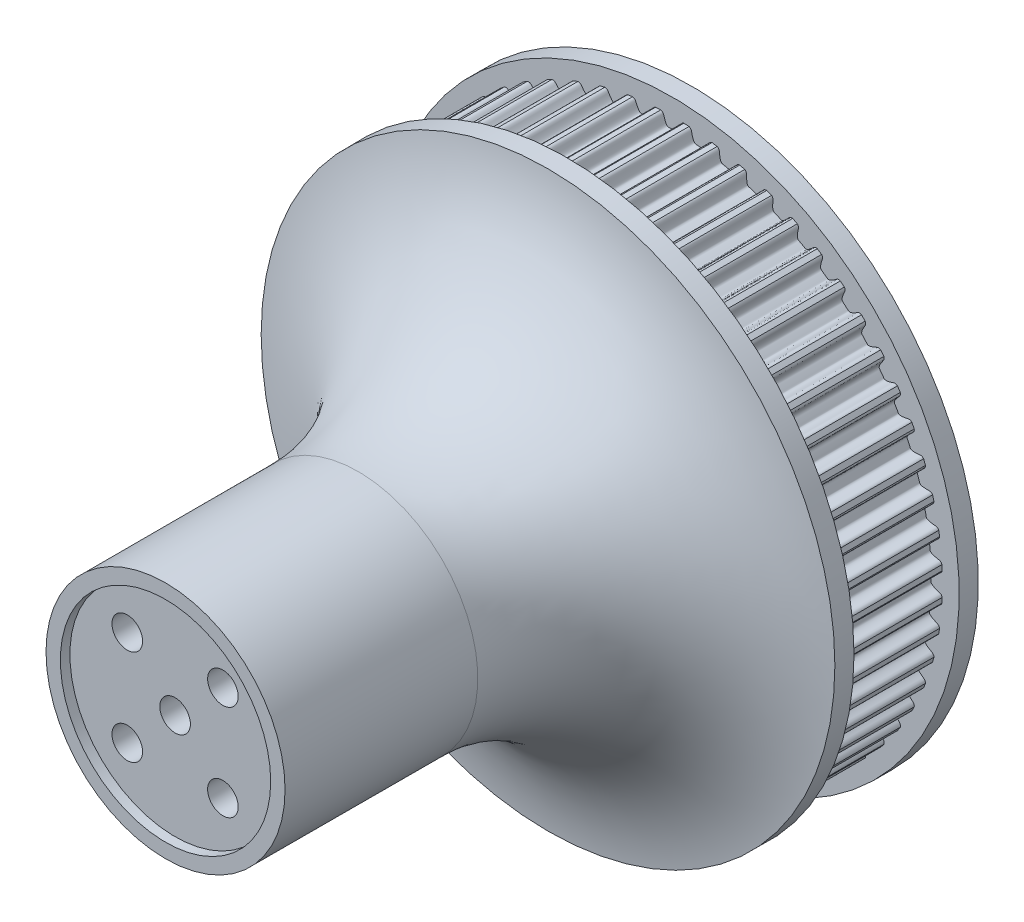
from build123d import *

# Parameters (mm, degrees)
TOOTHEXTRUDECUTGEARBELT01_DEPTH = 8.249999876
TOOTH_PATTERN_60_COUNT          = 60
BOREREVOLVESKETCH_W             = 19.547999706
BOREREVOLVESKETCH_H             = 5
SKETCH_5_R                      = 34.431410785
CUT_EXTRUDE_2_DEPTH             = 4.55
SKETCH_6_R                      = 32.21260367
CUT_EXTRUDE_3_DEPTH             = 4
SKETCH_7_R                      = 30
EXTRUDE_2_DEPTH                 = 2
EXTRUDE_START                   = 2
SKETCH_8_R                      = 30
EXTRUDE_3_DEPTH                 = 2
SKETCH_9_R                      = 19.144097689
EXTRUDE_4_DEPTH                 = 14
SKETCH_10_R                     = 12.5
EXTRUDE_6_DEPTH                 = 20
SKETCH_12_R                     = 1.6
CUT_EXTRUDE_4_DEPTH             = 55.998727217
SKETCH_13_R                     = 11
CUT_EXTRUDE_5_DEPTH             = 1
CUT_EXTRUDE_6_REACH             = 56.999
SKETCH_14_R                     = 1.9
SKETCH_15_R                     = 3.5
SKETCH_15_R_2                   = 3
CUT_EXTRUDE_7_DEPTH             = 20
EXTRUDE_START_2                 = 9
SKETCH_21_R                     = 12.5
SKETCH_21_R_2                   = 1.6
EXTRUDE_9_DEPTH                 = 9
EXTRUDE_START_3                 = 12
SKETCH_22_R                     = 12.5
SKETCH_22_R_2                   = 1.6
EXTRUDE_10_DEPTH                = 12
SKETCH_23_R                     = 3
SKETCH_23_R_2                   = 3.5
CUT_EXTRUDE_13_DEPTH            = 10
EXTRUDE_START_4                 = -2
SKETCH_24_R                     = 1.9
EXTRUDE_11_DEPTH                = 2
FILLET_6_R                      = 20
SKETCH_25_R                     = 11
CUT_EXTRUDE_14_DEPTH            = 1


with BuildPart() as part:
    # SketchRevolveGearBelt01 → Gates_PowerGrip_GT_3mm, 15mm Belt Width (revolve)
    with BuildSketch(Plane(origin=(0, 0, 0), x_dir=(0, 0, -1), z_dir=(1, 0, 0)), mode=Mode.PRIVATE) as gates_powergrip_gt_3mm_15mm_belt_width_sk:
        Polygon((9.773999853, 0), (9.773999853, 26.247889362), (9.011999865, 26.247889362), (9.011999865, 28.496318105), (9.480047286, 29.626284536), (8.776051092, 29.917889307), (8.249999876, 28.647889326), (8.249999876, 28.252919332), (-8.249999876, 28.252919332), (-8.249999876, 28.647889326), (-8.776051092, 29.917889307), (-9.480047286, 29.626284536), (-9.011999865, 28.496318105), (-9.011999865, 26.247889362), (-9.773999853, 26.247889362), (-9.773999853, 0), align=None)
    revolve(gates_powergrip_gt_3mm_15mm_belt_width_sk.sketch.rotate(Axis((0, 0, 0), (0, 0, -1)), 90), axis=Axis((0, 0, 0), (0, 0, -1)))

    # SketchToothGearBelt01 → ToothExtrudeCutGearBelt01 (cut, symmetric)
    with BuildSketch(Plane.XY):
        with BuildLine():
            ThreePointArc((28.236700974, 1.291128894), (28.266204126, 0), (28.236700974, -1.291128894))
            add(Edge.make_bspline(
                [(28.236700974, -1.291128894), (28.23639652, -1.265464926), (28.232210766, -1.227015858), (28.21936503, -1.177256927), (28.206189468, -1.141036186), (28.189594076, -1.106249243), (28.169732628, -1.073217977), (28.146788814, -1.042248472), (28.120975422, -1.013626108), (28.092529847, -0.987620561), (28.061721096, -0.964454821), (28.02881301, -0.944409427), (27.994189766, -0.927423169), (27.930800257, -0.904994578), (27.850847297, -0.880874674), (27.757056447, -0.851218147), (27.678383147, -0.824734225), (27.60446405, -0.798276401), (27.535308166, -0.771815981), (27.47091166, -0.74536021), (27.411273388, -0.71890735), (27.356390943, -0.692457579), (27.306261464, -0.666010094), (27.260881208, -0.639563429), (27.220245637, -0.613114736), (27.18434901, -0.586658928), (27.153186375, -0.560187301), (27.126750399, -0.533685798), (27.105050767, -0.507133275), (27.088069704, -0.480502635), (27.075940954, -0.453766913), (27.068379848, -0.426922601), (27.065077998, -0.375466934), (27.069851374, -0.299989788), (27.070067455, -0.19995905), (27.071220248, -0.099984782), (27.071391355, 0), (27.071220248, 0.099984782), (27.070067455, 0.19995905), (27.069851374, 0.299989788), (27.065077998, 0.375466934), (27.068379848, 0.426922601), (27.075940954, 0.453766913), (27.088069704, 0.480502635), (27.105050767, 0.507133275), (27.126750399, 0.533685798), (27.153186375, 0.560187301), (27.18434901, 0.586658928), (27.220245637, 0.613114736), (27.260881208, 0.639563429), (27.306261464, 0.666010094), (27.356390943, 0.692457579), (27.411273388, 0.71890735), (27.47091166, 0.74536021), (27.535308166, 0.771815981), (27.60446405, 0.798276401), (27.678383147, 0.824734225), (27.757056447, 0.851218147), (27.850847297, 0.880874674), (27.930800257, 0.904994578), (27.994189766, 0.927423169), (28.02881301, 0.944409427), (28.061721096, 0.964454821), (28.092529847, 0.987620561), (28.120975422, 1.013626108), (28.146788814, 1.042248472), (28.169732628, 1.073217977), (28.189594076, 1.106249243), (28.206189468, 1.141036186), (28.21936503, 1.177256927), (28.232210766, 1.227015858), (28.23639652, 1.265464926), (28.236700974, 1.291128894)],
                knots=[0, 0, 0, 0, 0.019512813, 0.029269219, 0.039025625, 0.048782032, 0.058538438, 0.068294844, 0.078051251, 0.087807657, 0.097564064, 0.10732047, 0.117076876, 0.126833283, 0.158411348, 0.180601822, 0.201643681, 0.221544022, 0.240311236, 0.257955332, 0.274488358, 0.289924961, 0.304283149, 0.317585307, 0.329859599, 0.341141892, 0.351478382, 0.360929145, 0.369572747, 0.377511751, 0.384878211, 0.391836853, 0.398582347, 0.423955538, 0.449303692, 0.474651846, 0.5, 0.525348154, 0.550696308, 0.576044462, 0.601417653, 0.608163147, 0.615121789, 0.622488249, 0.630427253, 0.639070855, 0.648521618, 0.658858108, 0.670140401, 0.682414693, 0.695716851, 0.710075039, 0.725511642, 0.742044668, 0.759688764, 0.778455978, 0.798356319, 0.819398178, 0.841588652, 0.873166717, 0.882923124, 0.89267953, 0.902435936, 0.912192343, 0.921948749, 0.931705156, 0.941461562, 0.951217968, 0.960974375, 0.970730781, 0.980487187, 1, 1, 1, 1], degree=3))
        make_face()
    toothextrudecutgearbelt01 = extrude(amount=TOOTHEXTRUDECUTGEARBELT01_DEPTH, both=True, mode=Mode.SUBTRACT)

    # Tooth Pattern, 60: ToothExtrudeCutGearBelt01 ×60 about axis
    tooth_pattern_60_axis = Axis((0, 0, 55), (0, 0, -1))
    for i in range(1, TOOTH_PATTERN_60_COUNT):
        add(toothextrudecutgearbelt01.rotate(tooth_pattern_60_axis, i * 360 / TOOTH_PATTERN_60_COUNT), mode=Mode.SUBTRACT)

    # BoreRevolveSketch → BoreRevolveCut (revolve, cut)
    with BuildSketch(Plane(origin=(0, 0, 0), x_dir=(0, 0, -1), z_dir=(1, 0, 0)), mode=Mode.PRIVATE) as borerevolvecut_sk:
        with Locations((0, 2.5)):
            Rectangle(BOREREVOLVESKETCH_W, BOREREVOLVESKETCH_H)
    revolve(borerevolvecut_sk.sketch.rotate(Axis((0, 0, 0), (0, 0, -1)), 90), axis=Axis((0, 0, 0), (0, 0, -1)), mode=Mode.SUBTRACT)

    # 草图5 → 切除-拉伸2 (cut)
    with BuildSketch(Plane.XY.offset(9.773999853)):
        Circle(SKETCH_5_R)
    extrude(amount=-CUT_EXTRUDE_2_DEPTH, mode=Mode.SUBTRACT)

    # 草图6 → 切除-拉伸3 (cut)
    with BuildSketch(Plane(origin=(0, 0, -9.773999853), x_dir=(-1, 0, 0), z_dir=(0, 0, -1))):
        Circle(SKETCH_6_R)
    extrude(amount=-CUT_EXTRUDE_3_DEPTH, mode=Mode.SUBTRACT)

    # 草图7 → 凸台-拉伸2 (add)
    with BuildSketch(Plane.XY.offset(5.223999853)):
        Circle(SKETCH_7_R)
    extrude(amount=EXTRUDE_2_DEPTH)

    # 草图8 → 凸台-拉伸3 (add)
    with BuildSketch(Plane(origin=(0, 0, -5.773999853), x_dir=(-1, 0, 0), z_dir=(0, 0, -1)).offset(EXTRUDE_START)):
        with Locations(Location((0, 0, 0), (0, 0, 180))):
            Circle(SKETCH_8_R)
    extrude(amount=-EXTRUDE_3_DEPTH)

    # 草图9 → 凸台-拉伸4 (add)
    with BuildSketch(Plane.XY.offset(7.223999853)):
        Circle(SKETCH_9_R)
    extrude(amount=-EXTRUDE_4_DEPTH)

    # 草图10 → 凸台-拉伸6 (add)
    with BuildSketch(Plane.XY.offset(7.223999853)):
        Circle(SKETCH_10_R)
    extrude(amount=EXTRUDE_6_DEPTH)

    # 草图12 → 切除-拉伸4 (cut, through all)
    with BuildSketch(Plane.XY.offset(27.223999853)):
        Circle(SKETCH_12_R)
        with Locations((-5, 5)):
            Circle(SKETCH_12_R)
        with Locations((5, 5)):
            Circle(SKETCH_12_R)
        with Locations((5, -5)):
            Circle(SKETCH_12_R)
        with Locations((-5, -5)):
            Circle(SKETCH_12_R)
    extrude(amount=-CUT_EXTRUDE_4_DEPTH, mode=Mode.SUBTRACT)

    # 草图13 → 切除-拉伸5 (cut)
    with BuildSketch(Plane.XY.offset(27.223999853)):
        Circle(SKETCH_13_R)
    extrude(amount=-CUT_EXTRUDE_5_DEPTH, mode=Mode.SUBTRACT)

    # 草图14 → 切除-拉伸6 (cut, up to next)
    with BuildSketch(Plane(origin=(0, 0, -7.773999853), x_dir=(-1, 0, 0), z_dir=(0, 0, -1)), mode=Mode.PRIVATE) as cut_extrude_6_sk1:
        with Locations((15.784545254, 14.818909588)):
            Circle(SKETCH_14_R)
    cut_extrude_6_tool1 = extrude(cut_extrude_6_sk1.sketch, amount=-CUT_EXTRUDE_6_REACH, mode=Mode.PRIVATE) & part.part
    # 草图14 → 切除-拉伸6 (cut, up to next)
    with BuildSketch(Plane(origin=(0, 0, -7.773999853), x_dir=(-1, 0, 0), z_dir=(0, 0, -1)), mode=Mode.PRIVATE) as cut_extrude_6_sk2:
        with Locations((1.784545254, 14.818909587)):
            Circle(SKETCH_14_R)
    cut_extrude_6_tool2 = extrude(cut_extrude_6_sk2.sketch, amount=-CUT_EXTRUDE_6_REACH, mode=Mode.PRIVATE) & part.part
    # 草图14 → 切除-拉伸6 (cut, up to next)
    with BuildSketch(Plane(origin=(0, 0, -7.773999853), x_dir=(-1, 0, 0), z_dir=(0, 0, -1)), mode=Mode.PRIVATE) as cut_extrude_6_sk3:
        with Locations((-12.215454746, 14.818909587)):
            Circle(SKETCH_14_R)
    cut_extrude_6_tool3 = extrude(cut_extrude_6_sk3.sketch, amount=-CUT_EXTRUDE_6_REACH, mode=Mode.PRIVATE) & part.part
    # 草图14 → 切除-拉伸6 (cut, up to next)
    with BuildSketch(Plane(origin=(0, 0, -7.773999853), x_dir=(-1, 0, 0), z_dir=(0, 0, -1)), mode=Mode.PRIVATE) as cut_extrude_6_sk4:
        with Locations((-5.265454745, -15.431090414)):
            Circle(SKETCH_14_R)
    cut_extrude_6_tool4 = extrude(cut_extrude_6_sk4.sketch, amount=-CUT_EXTRUDE_6_REACH, mode=Mode.PRIVATE) & part.part
    # 草图14 → 切除-拉伸6 (cut, up to next)
    with BuildSketch(Plane(origin=(0, 0, -7.773999853), x_dir=(-1, 0, 0), z_dir=(0, 0, -1)), mode=Mode.PRIVATE) as cut_extrude_6_sk5:
        with Locations((8.734545255, -15.431090414)):
            Circle(SKETCH_14_R)
    cut_extrude_6_tool5 = extrude(cut_extrude_6_sk5.sketch, amount=-CUT_EXTRUDE_6_REACH, mode=Mode.PRIVATE) & part.part
    add(cut_extrude_6_tool1.solids().sort_by_distance((-15.784545, 14.81891, -7.774))[0], mode=Mode.SUBTRACT)
    add(cut_extrude_6_tool2.solids().sort_by_distance((-1.784545, 14.81891, -7.774))[0], mode=Mode.SUBTRACT)
    add(cut_extrude_6_tool3.solids().sort_by_distance((12.215455, 14.81891, -7.774))[0], mode=Mode.SUBTRACT)
    add(cut_extrude_6_tool4.solids().sort_by_distance((5.265455, -15.43109, -7.774))[0], mode=Mode.SUBTRACT)
    add(cut_extrude_6_tool5.solids().sort_by_distance((-8.734545, -15.43109, -7.774))[0], mode=Mode.SUBTRACT)

    # 草图15 → 切除-拉伸7 (cut)
    with BuildSketch(Plane(origin=(0, 0, -7.773999853), x_dir=(-1, 0, 0), z_dir=(0, 0, -1))):
        Circle(SKETCH_15_R)
        with Locations((-5, 5)):
            Circle(SKETCH_15_R_2)
        with Locations((5, 5)):
            Circle(SKETCH_15_R_2)
        with Locations((5, -5)):
            Circle(SKETCH_15_R_2)
        with Locations((-5, -5)):
            Circle(SKETCH_15_R_2)
    extrude(amount=-CUT_EXTRUDE_7_DEPTH, mode=Mode.SUBTRACT)

    # 草图21 → 凸台-拉伸9 (add)
    with BuildSketch(Plane.XY.offset(26.223999853).offset(EXTRUDE_START_2)):
        Circle(SKETCH_21_R)
        Circle(SKETCH_21_R_2, mode=Mode.SUBTRACT)
        with Locations((5, -5)):
            Circle(SKETCH_21_R_2, mode=Mode.SUBTRACT)
        with Locations((-5, -5)):
            Circle(SKETCH_21_R_2, mode=Mode.SUBTRACT)
        with Locations((-5, 5)):
            Circle(SKETCH_21_R_2, mode=Mode.SUBTRACT)
        with Locations((5, 5)):
            Circle(SKETCH_21_R_2, mode=Mode.SUBTRACT)
    extrude(amount=-EXTRUDE_9_DEPTH)

    # 草图22 → 凸台-拉伸10 (add)
    with BuildSketch(Plane.XY.offset(35.223999853).offset(EXTRUDE_START_3)):
        Circle(SKETCH_22_R)
        with Locations((-5, 5)):
            Circle(SKETCH_22_R_2, mode=Mode.SUBTRACT)
        Circle(SKETCH_22_R_2, mode=Mode.SUBTRACT)
        with Locations((5, 5)):
            Circle(SKETCH_22_R_2, mode=Mode.SUBTRACT)
        with Locations((5, -5)):
            Circle(SKETCH_22_R_2, mode=Mode.SUBTRACT)
        with Locations((-5, -5)):
            Circle(SKETCH_22_R_2, mode=Mode.SUBTRACT)
    extrude(amount=-EXTRUDE_10_DEPTH)

    # 草图23 → 切除-拉伸13 (cut)
    with BuildSketch(Plane(origin=(0, 0, 12.226000147), x_dir=(-1, 0, 0), z_dir=(0, 0, -1))):
        with Locations((-5, 5)):
            Circle(SKETCH_23_R)
        Circle(SKETCH_23_R_2)
        with Locations((5, 5)):
            Circle(SKETCH_23_R)
        with Locations((5, -5)):
            Circle(SKETCH_23_R)
        with Locations((-5, -5)):
            Circle(SKETCH_23_R)
    extrude(amount=-CUT_EXTRUDE_13_DEPTH, mode=Mode.SUBTRACT)

    # 草图24 → 凸台-拉伸11 (add)
    with BuildSketch(Plane.XY.offset(7.223999853).offset(EXTRUDE_START_4)):
        with Locations(Location((-15.784545254, 14.818909588, 0), (0, 0, 180))):
            Circle(SKETCH_24_R)
        with Locations(Location((-1.784545254, 14.818909587, 0), (0, 0, 180))):
            Circle(SKETCH_24_R)
        with Locations(Location((12.215454746, 14.818909587, 0), (0, 0, 180))):
            Circle(SKETCH_24_R)
        with Locations(Location((-8.734545255, -15.431090414, 0), (0, 0, 180))):
            Circle(SKETCH_24_R)
        with Locations(Location((5.265454745, -15.431090414, 0), (0, 0, 180))):
            Circle(SKETCH_24_R)
    extrude(amount=EXTRUDE_11_DEPTH)

    # 圆角6
    # the kernel refuses this fillet: 20 mm, written as the material it adds along each edge
    with BuildSketch(Plane(origin=(0, 0, 7.223999853), x_dir=(1, 0, 0), z_dir=(0, -1, 0))) as fillet_6_piece_1:
        with BuildLine():
            CenterArc((32.5, 19.843134833), FILLET_6_R, 180, 82.819244219)
            Line((12.5, 19.843134833), (12.1, 19.843134833))
            Line((12.1, 19.843134833), (12.1, 0))
            Line((12.1, 0), (12.5, -0.4))
            ThreePointArc((12.5, -0.4), (21.25, -0.4), (29.95, -0.396862697))
            Line((29.95, -0.396862697), (30, 0))
        make_face()
    revolve(axis=Axis((0, 0, 7.223999853), (0, 0, 1)))

    # 草图25 → 切除-拉伸14 (cut)
    with BuildSketch(Plane.XY.offset(47.223999853)):
        Circle(SKETCH_25_R)
    extrude(amount=-CUT_EXTRUDE_14_DEPTH, mode=Mode.SUBTRACT)


solid = part.part
